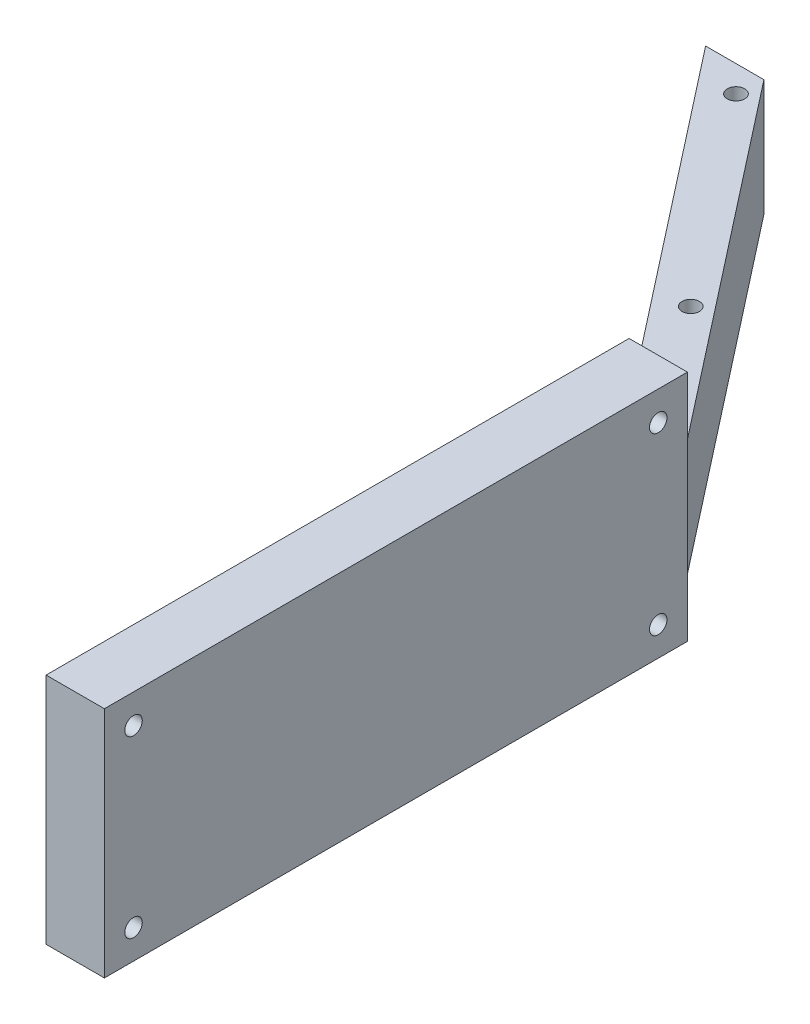
from build123d import *

# Parameters (mm, degrees)
SKETCH_1_W           = 100
SKETCH_1_H           = 40
EXTRUDE_1_DEPTH      = 10
EXTRUDE_2_DEPTH      = 30
SKETCH_4_R           = 1.5
CUT_EXTRUDE_1_DEPTH  = 127.085153879
CUT_EXTRUDE_2_DEPTH  = 10
SKETCH_7_R           = 1.5
CUT_EXTRUDE_3_DEPTH  = 10
CHAMFER_2_SIZE       = 0.5
EXTRUDE_3_DEPTH      = 6
EXTRUDE_3_DEPTH_BACK = 6
FILLET_1_R           = 5


with BuildPart() as part:
    # 草图1 → 凸台-拉伸1 (new body)
    with BuildSketch(Plane(origin=(0, 0, 0), x_dir=(0, 0, -1), z_dir=(1, 0, 0))):
        Rectangle(SKETCH_1_W, SKETCH_1_H)
    extrude(amount=EXTRUDE_1_DEPTH)

    # 草图3 → 凸台-拉伸2 (add)
    with BuildSketch(Plane(origin=(0, 20, 0), x_dir=(1, 0, 0), z_dir=(0, 1, 0))):
        Polygon((10, 50), (-36.87713759, 110), (-46.87713759, 110), (0, 50), align=None)
    extrude(amount=-EXTRUDE_2_DEPTH)

    # 草图4 → 切除-拉伸1 (cut, through all)
    with BuildSketch(Plane(origin=(0, 20, 0), x_dir=(1, 0, 0), z_dir=(0, 1, 0))):
        with Locations(Location((-37.168406916, 105.5, 0), (0, 0, 270))):
            Circle(SKETCH_4_R)
        with Locations(Location((-9.463640527, 70.039516088, 0), (0, 0, 270))):
            Circle(SKETCH_4_R)
    extrude(amount=-CUT_EXTRUDE_1_DEPTH, mode=Mode.SUBTRACT)

    # 草图5 → 切除-拉伸2 (cut)
    with BuildSketch(Plane(origin=(0, 20, 0), x_dir=(1, 0, 0), z_dir=(0, 1, 0))):
        Polygon((10, 50), (0, 50), (-46.87713759, 110), (-36.87713759, 110), align=None)
    extrude(amount=-CUT_EXTRUDE_2_DEPTH, mode=Mode.SUBTRACT)

    # 草图7 → 切除-拉伸3 (cut)
    with BuildSketch(Plane(origin=(10, 0, 0), x_dir=(0, 0, -1), z_dir=(1, 0, 0))):
        with Locations((-45, 15)):
            Circle(SKETCH_7_R)
        with Locations((-45, -15)):
            Circle(SKETCH_7_R)
        with Locations((45, -15)):
            Circle(SKETCH_7_R)
        with Locations((45, 15)):
            Circle(SKETCH_7_R)
    extrude(amount=-CUT_EXTRUDE_3_DEPTH, mode=Mode.SUBTRACT)

    # 倒角2
    chamfer_2_edges = [part.edges().sort_by_distance(p)[0] for p in [
        (0, 15, -43.5),
        (0, -15, -43.5),
        (0, -15, 46.5),
        (0, 15, 46.5),
    ]]
    chamfer(chamfer_2_edges, length=CHAMFER_2_SIZE)

    # 草图9 → 凸台-拉伸3 (add, two sides: drawn at the far end of the back side and taken through both)
    with BuildSketch(Plane(origin=(0, 0, 0), x_dir=(1, 0, 0), z_dir=(0, 1, 0)).offset(-EXTRUDE_3_DEPTH_BACK)):
        Polygon((-9.23492213, 61.820161304), (-12.339726869, 59.394421988), (-5, 50), (-5, 20), (0, 20), (0, 50), align=None)
    extrude(amount=EXTRUDE_3_DEPTH + EXTRUDE_3_DEPTH_BACK)

    # 圆角1
    # the kernel refuses this fillet: 5 mm, written as the material it takes off along each edge
    with BuildSketch(Plane(origin=(-5, -18.5, -20), x_dir=(1, 0, 0), z_dir=(0, 1, 0))) as fillet_1_piece_1:
        with BuildLine():
            CenterArc((FILLET_1_R, FILLET_1_R), FILLET_1_R, 180, 90)
            Line((0, FILLET_1_R), (-FILLET_1_R * 0.02, FILLET_1_R))
            Line((-FILLET_1_R * 0.02, FILLET_1_R), (-FILLET_1_R * 0.02, -FILLET_1_R * 0.02))
            Line((-FILLET_1_R * 0.02, -FILLET_1_R * 0.02), (FILLET_1_R, -FILLET_1_R * 0.02))
            Line((FILLET_1_R, -FILLET_1_R * 0.02), (FILLET_1_R, 0))
        make_face()
    extrude(amount=37, mode=Mode.SUBTRACT)
    with BuildSketch(Plane(origin=(-12.339726869, -18.215899984, -59.394421988), x_dir=(0.7880107536067237, 0, -0.6156614753256561), z_dir=(0, 1, 0))) as fillet_1_piece_2:
        with BuildLine():
            CenterArc((5, -4.886359993), FILLET_1_R, 102.23895269, 77.76104731)
            Line((0, -4.886359993), (-0.1, -4.886359993))
            Line((-0.1, -4.886359993), (-0.1, 0))
            Line((-0.1, 0), (0, 0.1))
            ThreePointArc((0, 0.1), (1.970026884, 0.1), (3.918854843, 0.0977272))
            Line((3.918854843, 0.0977272), (3.940053768, 0))
        make_face()
    extrude(amount=36.431799967, mode=Mode.SUBTRACT)


solid = part.part
